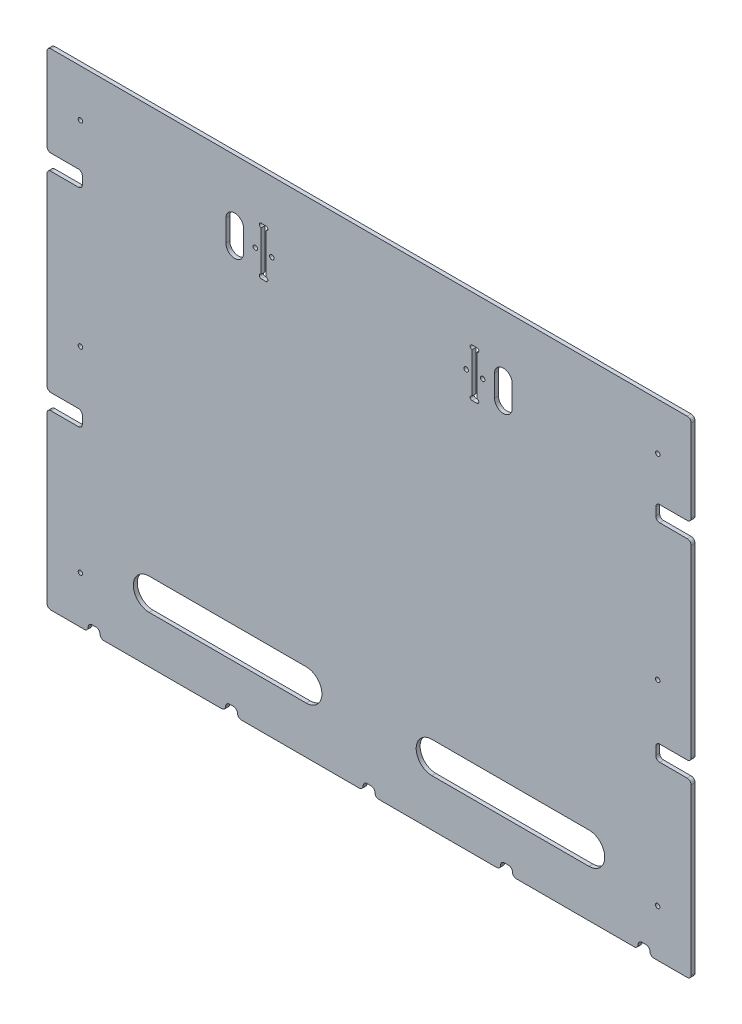
from build123d import *

# Parameters (mm, degrees)
SKETCH1_W               = 1041.4
SKETCH1_H               = 785.8125
BOSS_EXTRUDE1_DEPTH     = 6.35
CUT_EXTRUDE5_DEPTH      = 1305.62851711
F_1_4_CLEARANCE_HOLE1_D = 7.14248
CUT_EXTRUDE6_DEPTH      = 1305.62851711
SKETCH13_W              = 57.15
SKETCH13_H              = 25.4
CUT_EXTRUDE7_DEPTH      = 1305.62851711
FILLET1_R               = 6.35
FILLET1_OF_MIRROR1_R    = 6.35
CUT_EXTRUDE8_DEPTH      = 1305.62851711
LPATTERN1_COUNT         = 5
LPATTERN1_PITCH         = 222.25
CUT_EXTRUDE9_DEPTH      = 1305.62851711
LPATTERN2_COUNT         = 2
LPATTERN2_PITCH         = 457.2
FILLET2_R               = 6.35


with BuildPart() as part:
    # Sketch1 → Boss-Extrude1 (new body)
    with BuildSketch(Plane.XY):
        with Locations((520.7, 392.90625)):
            Rectangle(SKETCH1_W, SKETCH1_H)
    extrude(amount=BOSS_EXTRUDE1_DEPTH)

    # Sketch11 → Cut-Extrude5 (cut, through all)
    with BuildSketch(Plane.XY.offset(6.35)):
        with BuildLine():
            Line((346.3925, 640.207), (346.3925, 705.2945))
            ThreePointArc((346.3925, 705.2945), (343.2175, 708.4695), (346.3925, 711.6445))
            Line((346.3925, 711.6445), (354.0125, 711.6445))
            ThreePointArc((354.0125, 711.6445), (357.1875, 708.4695), (354.0125, 705.2945))
            Line((354.0125, 705.2945), (354.0125, 640.207))
            ThreePointArc((354.0125, 640.207), (357.1875, 637.032), (354.0125, 633.857))
            Line((354.0125, 633.857), (346.3925, 633.857))
            ThreePointArc((346.3925, 633.857), (343.2175, 637.032), (346.3925, 640.207))
        make_face()
        with BuildLine():
            Line((695.0075, 633.857), (687.3875, 633.857))
            ThreePointArc((687.3875, 633.857), (684.2125, 637.032), (687.3875, 640.207))
            Line((687.3875, 640.207), (687.3875, 705.2945))
            ThreePointArc((687.3875, 705.2945), (684.2125, 708.4695), (687.3875, 711.6445))
            Line((687.3875, 711.6445), (695.0075, 711.6445))
            ThreePointArc((695.0075, 711.6445), (698.1825, 708.4695), (695.0075, 705.2945))
            Line((695.0075, 705.2945), (695.0075, 640.207))
            ThreePointArc((695.0075, 640.207), (698.1825, 637.032), (695.0075, 633.857))
        make_face()
    extrude(amount=-CUT_EXTRUDE5_DEPTH, mode=Mode.SUBTRACT)

    # 1/4 Clearance Hole1 (through all)
    with Locations(Plane.XY.offset(6.35)):
        with Locations((54.102, 709.6125), (54.102, 76.2), (54.102, 392.90625), (987.298, 76.2), (987.298, 392.90625), (987.425, 709.6125), (336.8675, 672.75075), (363.5375, 672.75075), (677.8625, 672.75075), (704.5325, 672.75075)):
            Hole(F_1_4_CLEARANCE_HOLE1_D / 2)

    # Sketch12 → Cut-Extrude6 (cut, through all)
    with BuildSketch(Plane.XY.offset(6.35)):
        with BuildLine():
            Line((289.2425, 655.28825), (289.2425, 690.21325))
            ThreePointArc((289.2425, 690.21325), (303.53, 704.50075), (317.8175, 690.21325))
            Line((317.8175, 690.21325), (317.8175, 655.28825))
            ThreePointArc((317.8175, 655.28825), (303.53, 641.00075), (289.2425, 655.28825))
        make_face()
        with BuildLine():
            Line((752.1575, 655.28825), (752.1575, 690.21325))
            ThreePointArc((752.1575, 690.21325), (737.87, 704.50075), (723.5825, 690.21325))
            Line((723.5825, 690.21325), (723.5825, 655.28825))
            ThreePointArc((723.5825, 655.28825), (737.87, 641.00075), (752.1575, 655.28825))
        make_face()
    extrude(amount=-CUT_EXTRUDE6_DEPTH, mode=Mode.SUBTRACT)

    # Sketch13 → Cut-Extrude7 (cut, through all)
    with BuildSketch(Plane(origin=(0, 0, 0), x_dir=(-1, 0, 0), z_dir=(0, 0, -1))):
        with Locations((-1012.825, 627.0625)):
            Rectangle(SKETCH13_W, SKETCH13_H)
        with Locations((-1012.825, 291.7825)):
            Rectangle(SKETCH13_W, SKETCH13_H)
    cut_extrude7 = extrude(amount=-CUT_EXTRUDE7_DEPTH, mode=Mode.SUBTRACT)

    # Fillet1
    fillet1_edges = [part.edges().sort_by_distance(p)[0] for p in [
        (984.25, 639.7625, 3.175),
        (984.25, 614.3625, 3.175),
        (984.25, 304.4825, 3.175),
        (984.25, 279.0825, 3.175),
    ]]
    fillet(fillet1_edges, radius=FILLET1_R)

    # Mirror1: Cut-Extrude7 across plane
    add(cut_extrude7.mirror(Plane(origin=(520.7, 0, 0), x_dir=(0, 0, 1), z_dir=(1, 0, 0))), mode=Mode.SUBTRACT)

    # Fillet1 of Mirror1
    fillet1_of_mirror1_edges = [part.edges().sort_by_distance(p)[0] for p in [
        (57.15, 639.7625, 3.175),
        (57.15, 614.3625, 3.175),
        (57.15, 304.4825, 3.175),
        (57.15, 279.0825, 3.175),
    ]]
    fillet(fillet1_of_mirror1_edges, radius=FILLET1_OF_MIRROR1_R)

    # Sketch16 → Cut-Extrude8 (cut, through all)
    with BuildSketch(Plane.XY.offset(6.35)):
        with BuildLine():
            Line((66.675, 0), (85.725, 0))
            Line((85.725, 0), (85.725, 6.35))
            ThreePointArc((85.725, 6.35), (83.865128061, 10.840128061), (79.375, 12.7))
            Line((79.375, 12.7), (73.025, 12.7))
            ThreePointArc((73.025, 12.7), (68.534871939, 10.840128061), (66.675, 6.35))
            Line((66.675, 6.35), (66.675, 0))
        make_face()
    cut_extrude8 = extrude(amount=-CUT_EXTRUDE8_DEPTH, mode=Mode.SUBTRACT)

    # LPattern1: Cut-Extrude8 ×5
    with Locations(*[(i * LPATTERN1_PITCH, 0, 0) for i in range(1, LPATTERN1_COUNT)]):
        add(cut_extrude8, mode=Mode.SUBTRACT)

    # Sketch17 → Cut-Extrude9 (cut, through all)
    with BuildSketch(Plane.XY.offset(6.35)):
        with BuildLine():
            Line((419.1, 76.2), (165.1, 76.2))
            ThreePointArc((165.1, 76.2), (139.7, 101.6), (165.1, 127))
            Line((165.1, 127), (419.1, 127))
            ThreePointArc((419.1, 127), (444.5, 101.6), (419.1, 76.2))
        make_face()
    cut_extrude9 = extrude(amount=-CUT_EXTRUDE9_DEPTH, mode=Mode.SUBTRACT)

    # LPattern2: Cut-Extrude9 ×2
    with Locations(*[(i * LPATTERN2_PITCH, 0, 0) for i in range(1, LPATTERN2_COUNT)]):
        add(cut_extrude9, mode=Mode.SUBTRACT)

    # Fillet2
    fillet2_edges = [part.edges().sort_by_distance(p)[0] for p in [
        (0, 785.8125, 3.175),
        (0, 639.7625, 3.175),
        (0, 614.3625, 3.175),
        (0, 304.4825, 3.175),
        (0, 279.0825, 3.175),
        (0, 0, 3.175),
        (66.675, 0, 3.175),
        (85.725, 0, 3.175),
        (288.925, 0, 3.175),
        (307.975, 0, 3.175),
        (511.175, 0, 3.175),
        (530.225, 0, 3.175),
        (733.425, 0, 3.175),
        (752.475, 0, 3.175),
        (955.675, 0, 3.175),
        (974.725, 0, 3.175),
        (1041.4, 0, 3.175),
        (1041.4, 279.0825, 3.175),
        (1041.4, 304.4825, 3.175),
        (1041.4, 614.3625, 3.175),
        (1041.4, 639.7625, 3.175),
        (1041.4, 785.8125, 3.175),
    ]]
    fillet(fillet2_edges, radius=FILLET2_R - 0.0001)  # a hair under: the kernel refuses the full size


solid = part.part
